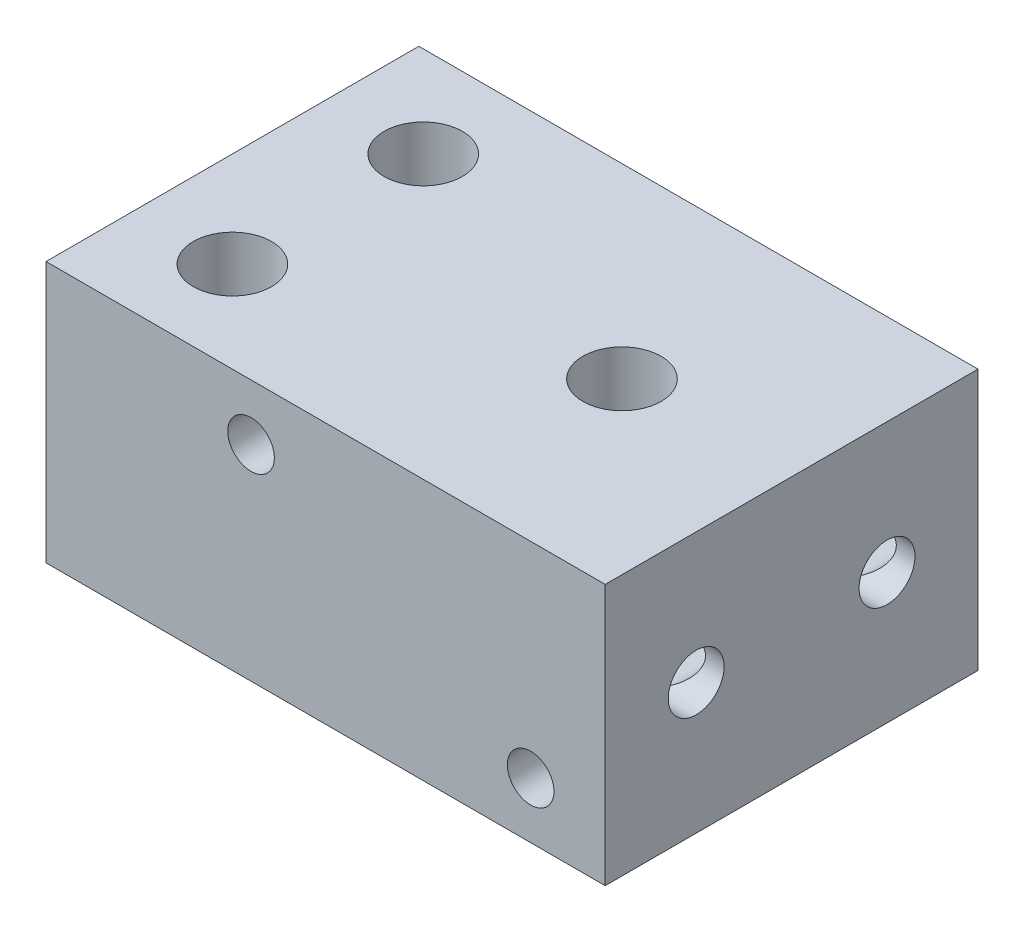
from build123d import *

# Parameters (mm, degrees)
SKETCH1_W                    = 30
SKETCH1_H                    = 14
BOSS_EXTRUDE1_DEPTH          = 10
SKETCH3_R                    = 1
CUT_EXTRUDE2_DEPTH           = 23.825424421
M5_TAPPED_HOLE1_D            = 4.2
M5_TAPPED_HOLE1_DEPTH        = 8
M5_TAPPED_HOLE1_TIP          = 1.2618073
F_3_0_3_DIAMETER_HOLE4_D     = 3
F_3_0_3_DIAMETER_HOLE4_DEPTH = 15
F_3_0_3_DIAMETER_HOLE4_TIP   = 0.901290929
F_3_0_3_DIAMETER_HOLE5_D     = 3
F_3_0_3_DIAMETER_HOLE5_DEPTH = 25
F_3_0_3_DIAMETER_HOLE5_TIP   = 0.901290929
M3_TAPPED_HOLE1_D            = 2.5
M3_TAPPED_HOLE1_DEPTH        = 7.5
M3_TAPPED_HOLE1_TIP          = 0.751075774


with BuildPart() as part:
    # Sketch1 → Boss-Extrude1 (new, symmetric)
    with BuildSketch(Plane.XY):
        Rectangle(SKETCH1_W, SKETCH1_H)
    extrude(amount=BOSS_EXTRUDE1_DEPTH, both=True)

    # Sketch3 → Cut-Extrude2 (cut, through all)
    with BuildSketch(Plane(origin=(0, 7, 0), x_dir=(1, 0, 0), z_dir=(0, 1, 0))):
        with Locations((5.9, 0)):
            Circle(SKETCH3_R)
    extrude(amount=-CUT_EXTRUDE2_DEPTH, mode=Mode.SUBTRACT)

    # M5 Tapped Hole1
    with Locations(Plane(origin=(0, 7, 0), x_dir=(1, 0, 0), z_dir=(0, 1, 0))):
        with Locations((5.9, 0)):
            Hole(M5_TAPPED_HOLE1_D / 2, depth=M5_TAPPED_HOLE1_DEPTH)
            with Locations((0, 0, -(M5_TAPPED_HOLE1_DEPTH + M5_TAPPED_HOLE1_TIP / 2))):  # 118° drill point
                Cone(0, M5_TAPPED_HOLE1_D / 2, M5_TAPPED_HOLE1_TIP, mode=Mode.SUBTRACT)

    # Sketch7 → M5 Tapped Hole2 (revolve, cut)
    with BuildSketch(Plane(origin=(-9.881197846, 7, -5.118802154), x_dir=(0, 0, 1), z_dir=(1, 0, 0))):
        Polygon((0, 0), (0, 11.2618073), (2.1, 10), (2.1, 0), align=None)
    m5_tapped_hole2 = revolve(axis=Axis((-9.881197846, 13.35, -5.118802154), (0, -1, 0)), mode=Mode.SUBTRACT)

    # Mirror1: M5 Tapped Hole2 across plane
    add(m5_tapped_hole2.mirror(Plane.XY), mode=Mode.SUBTRACT)

    # Ø3.0 (3) Diameter Hole4
    with Locations(Plane(origin=(0, 0, -10), x_dir=(-1, 0, 0), z_dir=(0, 0, -1))):
        with Locations((-12.5, 0)):
            Hole(F_3_0_3_DIAMETER_HOLE4_D / 2, depth=F_3_0_3_DIAMETER_HOLE4_DEPTH)
            with Locations((0, 0, -(F_3_0_3_DIAMETER_HOLE4_DEPTH + F_3_0_3_DIAMETER_HOLE4_TIP / 2))):  # 118° drill point
                Cone(0, F_3_0_3_DIAMETER_HOLE4_D / 2, F_3_0_3_DIAMETER_HOLE4_TIP, mode=Mode.SUBTRACT)

    # Ø3.0 (3) Diameter Hole5
    with Locations(Plane(origin=(15, 0, 0), x_dir=(0, 0, -1), z_dir=(1, 0, 0))):
        with Locations((-5.118802154, 0), (5.118802154, 0)):
            Hole(F_3_0_3_DIAMETER_HOLE5_D / 2, depth=F_3_0_3_DIAMETER_HOLE5_DEPTH)
            with Locations((0, 0, -(F_3_0_3_DIAMETER_HOLE5_DEPTH + F_3_0_3_DIAMETER_HOLE5_TIP / 2))):  # 118° drill point
                Cone(0, F_3_0_3_DIAMETER_HOLE5_D / 2, F_3_0_3_DIAMETER_HOLE5_TIP, mode=Mode.SUBTRACT)

    # M3 Tapped Hole1
    with Locations(Plane.XY.offset(10)):
        with Locations((-4, 4), (11, -4)):
            Hole(M3_TAPPED_HOLE1_D / 2, depth=M3_TAPPED_HOLE1_DEPTH)
            with Locations((0, 0, -(M3_TAPPED_HOLE1_DEPTH + M3_TAPPED_HOLE1_TIP / 2))):  # 118° drill point
                Cone(0, M3_TAPPED_HOLE1_D / 2, M3_TAPPED_HOLE1_TIP, mode=Mode.SUBTRACT)


solid = part.part
